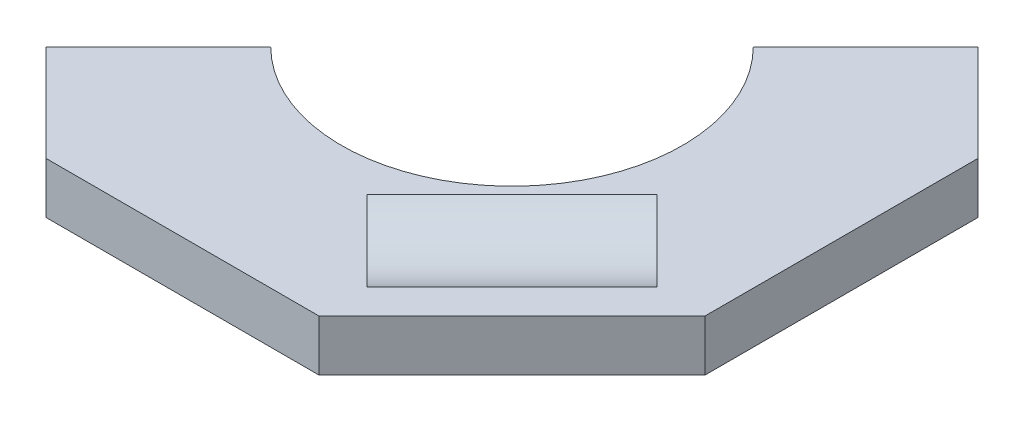
from build123d import *

# Parameters (mm, degrees)
STOCK_A_0101_1_DEPTH    = 19.05
CUT_EXTRUDE1_DEPTH      = 38.1
CUT_EXTRUDE1_DEPTH_BACK = 38.1
SKETCH1_R               = 31.115


# Read off the part's stored shape, not the designer's step: Stock-A-0101-1
with BuildPart() as part:
    # Stock-A-0101-1 outline → Stock-A-0101-1 (new body)
    with BuildSketch(Plane(origin=(0, 0, 0), x_dir=(1, 0, 0), z_dir=(0, 1, 0))):
        with BuildLine():
            Line((86.721024484, 86.721024484), (44.901280605, 44.901280605))
            ThreePointArc((44.901280605, 44.901280605), (44.901280605, -44.901280605), (-44.901280605, -44.901280605))
            Line((-44.901280605, -44.901280605), (-86.721024484, -86.721024484))
            Line((-86.721024484, -86.721024484), (-50.8, -122.642048969))
            Line((-50.8, -122.642048969), (50.8, -122.642048969))
            Line((50.8, -122.642048969), (122.642048969, -50.8))
            Line((122.642048969, -50.8), (122.642048969, 50.8))
            Line((122.642048969, 50.8), (86.721024484, 86.721024484))
        make_face()
    extrude(amount=STOCK_A_0101_1_DEPTH)

    # Sketch1 → Cut-Extrude1 (cut, two sides: drawn at the far end of the back side and taken through both)
    with BuildSketch(Plane(origin=(0, 0, 0), x_dir=(-0.7071067811865475, 0, -0.7071067811865477), z_dir=(0.7071067811865477, 0, -0.7071067811865475)).offset(-CUT_EXTRUDE1_DEPTH_BACK)):
        with Locations((-88.352048969, 41.91)):
            Circle(SKETCH1_R)
    extrude(amount=CUT_EXTRUDE1_DEPTH + CUT_EXTRUDE1_DEPTH_BACK, mode=Mode.SUBTRACT)


solid = part.part
